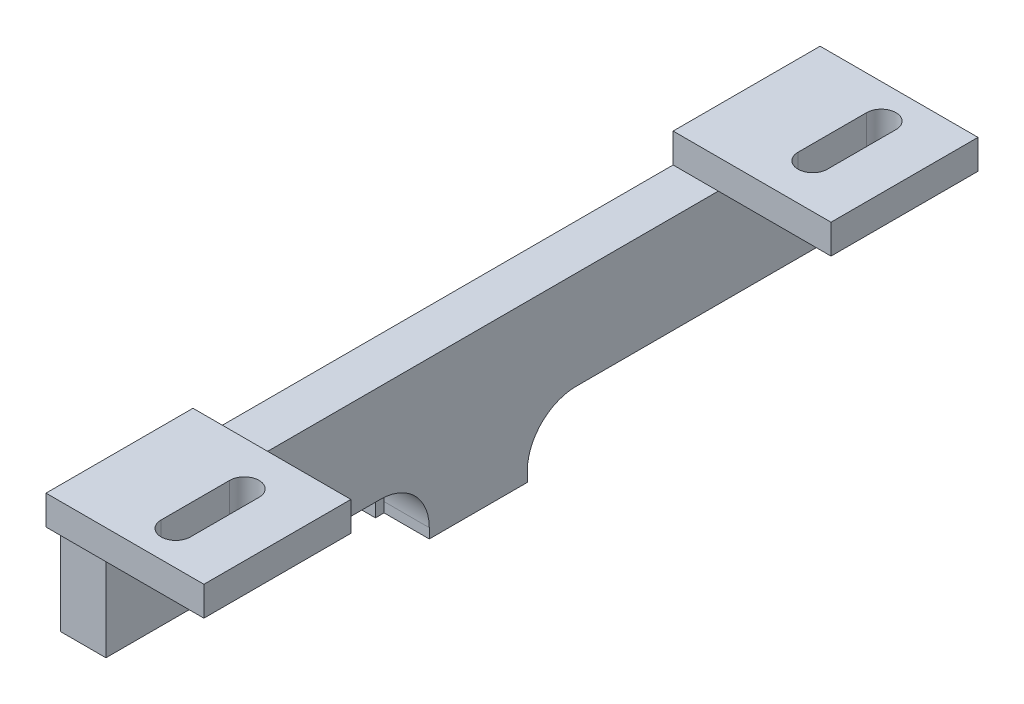
from build123d import *

# Parameters (mm, degrees)
SKETCH1_R           = 1.5
BOSS_EXTRUDE1_DEPTH = 3
SKETCH3_W           = 4.615398666
SKETCH3_H           = 10
BOSS_EXTRUDE2_DEPTH = 12.9997796
FILLET7_R           = 1
CUT_EXTRUDE4_DEPTH  = 10
FILLET8_R           = 4
SKETCH8_W           = 76
SKETCH8_H           = 10
BOSS_EXTRUDE3_DEPTH = 4.615398666
SKETCH9_W           = 14.615398666
SKETCH9_H           = 12
SKETCH9_R           = 1.5
BOSS_EXTRUDE4_DEPTH = 3
FILLET9_R           = 5
FILLET10_R          = 5
SKETCH10_W          = 9.773230982
SKETCH10_H          = 9.985016007
SKETCH10_W_2        = 12.713773796
SKETCH10_H_2        = 7.76031956
CUT_EXTRUDE6_DEPTH  = 10
CUT_EXTRUDE7_DEPTH  = 46.992324429
BOSS_EXTRUDE5_DEPTH = 3


with BuildPart() as part:
    # Sketch1 → Boss-Extrude1 (new body)
    with BuildSketch(Plane(origin=(0, 0, 0), x_dir=(1, 0, 0), z_dir=(0, 1, 0))):
        Polygon((-3, -11.32792047), (3, -11.32792047), (3, -5), (7.615398666, -5), (7.615398666, 5), (3, 5), (3, 11.32792047), (-3, 11.32792047), align=None)
        with Locations(Location((0, 8.5, 0), (0, 0, 270))):
            Circle(SKETCH1_R, mode=Mode.SUBTRACT)
        with Locations(Location((0, -8.5, 0), (0, 0, 270))):
            Circle(SKETCH1_R, mode=Mode.SUBTRACT)
    extrude(amount=BOSS_EXTRUDE1_DEPTH)

    # Sketch3 → Boss-Extrude2 (add)
    with BuildSketch(Plane(origin=(0, 3, 0), x_dir=(1, 0, 0), z_dir=(0, 1, 0))):
        with Locations((5.307699333, 0)):
            Rectangle(SKETCH3_W, SKETCH3_H)
    extrude(amount=BOSS_EXTRUDE2_DEPTH)

    # Fillet7
    fillet7_edges = [part.edges().sort_by_distance(p)[0] for p in [
        (3, 1.5, 11.32792047),
        (3, 1.5, -11.32792047),
    ]]
    fillet(fillet7_edges, radius=FILLET7_R)

    # Sketch7 → Cut-Extrude4 (cut)
    with BuildSketch(Plane.XZ):
        with BuildLine():
            Line((-3.65526474, -6.392053518), (-3.78188192, 6.478485425))
            ThreePointArc((-3.78188192, 6.478485425), (-0.319780446, 0.076652438), (-3.65526474, -6.392053518))
        make_face()
    extrude(amount=-CUT_EXTRUDE4_DEPTH, mode=Mode.SUBTRACT)

    # Fillet8
    fillet8_edges = [part.edges().sort_by_distance(p)[0] for p in [
        (3, 3, 0),
    ]]
    fillet(fillet8_edges, radius=FILLET8_R)

    # Sketch8 → Boss-Extrude3 (add)
    with BuildSketch(Plane(origin=(7.615398666, 0, 0), x_dir=(0, 0, -1), z_dir=(1, 0, 0))):
        with Locations((0, 10.9997796)):
            Rectangle(SKETCH8_W, SKETCH8_H)
    extrude(amount=-BOSS_EXTRUDE3_DEPTH)

    # Sketch9 → Boss-Extrude4 (add)
    # profile 1 of 2: a face of its own
    with BuildSketch(Plane(origin=(0, 15.9997796, 0), x_dir=(1, 0, 0), z_dir=(0, 1, 0))):
        with Locations((10.307699333, 32)):
            Rectangle(SKETCH9_W, SKETCH9_H)
        with Locations(Location((12.745112207, 32.5, 0), (0, 0, 270))):
            Circle(SKETCH9_R, mode=Mode.SUBTRACT)
    # profile 2 of 2: a face of its own
    with BuildSketch(Plane(origin=(0, 15.9997796, 0), x_dir=(1, 0, 0), z_dir=(0, 1, 0))):
        with Locations((10.307699333, -32)):
            Rectangle(SKETCH9_W, SKETCH9_H)
        with Locations(Location((12.745112207, -32.5, 0), (0, 0, 270))):
            Circle(SKETCH9_R, mode=Mode.SUBTRACT)
    extrude(amount=BOSS_EXTRUDE4_DEPTH)

    # Fillet9
    # the kernel refuses this fillet: 5 mm, written as the material it adds along each edge
    with BuildSketch(Plane(origin=(7.615398666, 5.9997796, 5), x_dir=(0, -1, 0), z_dir=(-1, 0, 0))) as fillet9_piece_1:
        with BuildLine():
            CenterArc((FILLET9_R, FILLET9_R), FILLET9_R, 180, 90)
            Line((0, FILLET9_R), (0, 0))
            Line((0, 0), (FILLET9_R, 0))
        make_face()
    extrude(amount=4.615398666)

    # Fillet10
    # the kernel refuses this fillet: 5 mm, written as the material it adds along each edge
    with BuildSketch(Plane(origin=(3, 5.9997796, -5), x_dir=(0, -1, 0), z_dir=(1, 0, 0))) as fillet10_piece_1:
        with BuildLine():
            CenterArc((FILLET10_R, FILLET10_R), FILLET10_R, 180, 90)
            Line((0, FILLET10_R), (0, 0))
            Line((0, 0), (FILLET10_R, 0))
        make_face()
    extrude(amount=4.615398666)

    # Sketch10 → Cut-Extrude6 (cut)
    with BuildSketch(Plane(origin=(0, 3, 0), x_dir=(1, 0, 0), z_dir=(0, 1, 0))):
        with Locations((-1.330252474, 10.872508004)):
            Rectangle(SKETCH10_W, SKETCH10_H)
        with Locations((-2.800523881, -9.76015978)):
            Rectangle(SKETCH10_W_2, SKETCH10_H_2)
    extrude(amount=-CUT_EXTRUDE6_DEPTH, mode=Mode.SUBTRACT)

    # Sketch11 → Cut-Extrude7 (cut, through all)
    with BuildSketch(Plane(origin=(0, 18.9997796, 0), x_dir=(1, 0, 0), z_dir=(0, 1, 0))):
        with BuildLine():
            Line((14.245112207, 36), (14.245112207, 29))
            ThreePointArc((14.245112207, 29), (12.745112207, 27.5), (11.245112207, 29))
            Line((11.245112207, 29), (11.245112207, 36))
            ThreePointArc((11.245112207, 36), (12.745112207, 37.5), (14.245112207, 36))
        make_face()
        with BuildLine():
            Line((14.245112207, -29), (14.245112207, -36))
            ThreePointArc((14.245112207, -36), (12.745112207, -37.5), (11.245112207, -36))
            Line((11.245112207, -36), (11.245112207, -29))
            ThreePointArc((11.245112207, -29), (12.745112207, -27.5), (14.245112207, -29))
        make_face()
    extrude(amount=-CUT_EXTRUDE7_DEPTH, mode=Mode.SUBTRACT)

    # Sketch13 → Boss-Extrude5 (add)
    with BuildSketch(Plane(origin=(0, 18.9997796, 0), x_dir=(1, 0, 0), z_dir=(0, 1, 0))):
        Polygon((3, -38), (3, -39.5), (19.115398666, -39.5), (19.115398666, -24.5), (3, -24.5), (3, -26), (17.615398666, -26), (17.615398666, -38), align=None)
        Polygon((3, 26), (3, 24.5), (19.115398666, 24.5), (19.115398666, 39.5), (3, 39.5), (3, 38), (17.615398666, 38), (17.615398666, 26), align=None)
    extrude(amount=-BOSS_EXTRUDE5_DEPTH)


solid = part.part
